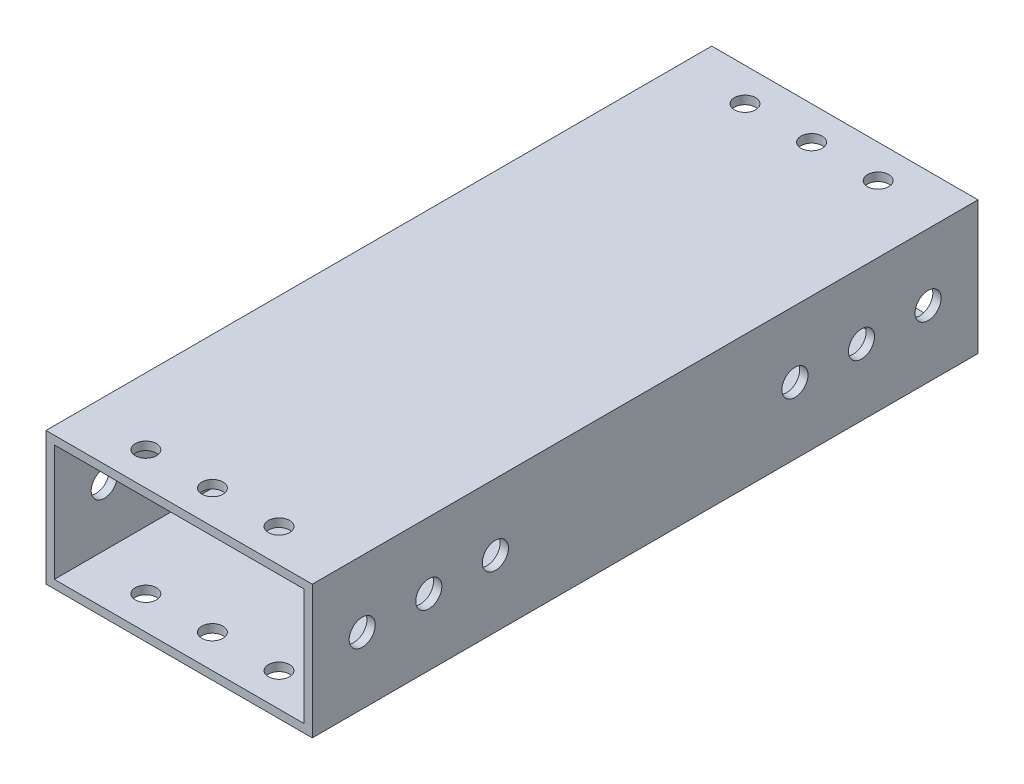
from build123d import *

# Parameters (mm, degrees)
SKETCH1_W           = 50.8
SKETCH1_H           = 25.4
SKETCH1_W_2         = 47.625
SKETCH1_H_2         = 22.225
BOSS_EXTRUDE1_DEPTH = 63.5
SKETCH2_R           = 2.0193
CUT_EXTRUDE1_DEPTH  = 73.955945611
SKETCH3_R           = 2.4892
CUT_EXTRUDE2_DEPTH  = 83.30540687


with BuildPart() as part:
    # Sketch1 → Boss-Extrude1 (new, symmetric)
    with BuildSketch(Plane.XY):
        Rectangle(SKETCH1_W, SKETCH1_H)
        Rectangle(SKETCH1_W_2, SKETCH1_H_2, mode=Mode.SUBTRACT)
    extrude(amount=BOSS_EXTRUDE1_DEPTH, both=True)

    # Sketch2 → Cut-Extrude1 (cut, through all)
    with BuildSketch(Plane(origin=(0, 12.7, 0), x_dir=(1, 0, 0), z_dir=(0, 1, 0))):
        with Locations((-12.7, 57.15)):
            Circle(SKETCH2_R)
        with Locations((0, 57.15)):
            Circle(SKETCH2_R)
        with Locations((12.7, 57.15)):
            Circle(SKETCH2_R)
        with Locations((12.7, -57.15)):
            Circle(SKETCH2_R)
        with Locations((0, -57.15)):
            Circle(SKETCH2_R)
        with Locations((-12.7, -57.15)):
            Circle(SKETCH2_R)
    extrude(amount=-CUT_EXTRUDE1_DEPTH, mode=Mode.SUBTRACT)

    # Sketch3 → Cut-Extrude2 (cut, through all)
    with BuildSketch(Plane(origin=(25.4, 0, 0), x_dir=(0, 0, -1), z_dir=(1, 0, 0))):
        with Locations((-53.975, 0)):
            Circle(SKETCH3_R)
        with Locations((53.975, 0)):
            Circle(SKETCH3_R)
        with Locations((-41.275, 0)):
            Circle(SKETCH3_R)
        with Locations((-28.575, 0)):
            Circle(SKETCH3_R)
        with Locations((28.575, 0)):
            Circle(SKETCH3_R)
        with Locations((41.275, 0)):
            Circle(SKETCH3_R)
    extrude(amount=-CUT_EXTRUDE2_DEPTH, mode=Mode.SUBTRACT)


solid = part.part
